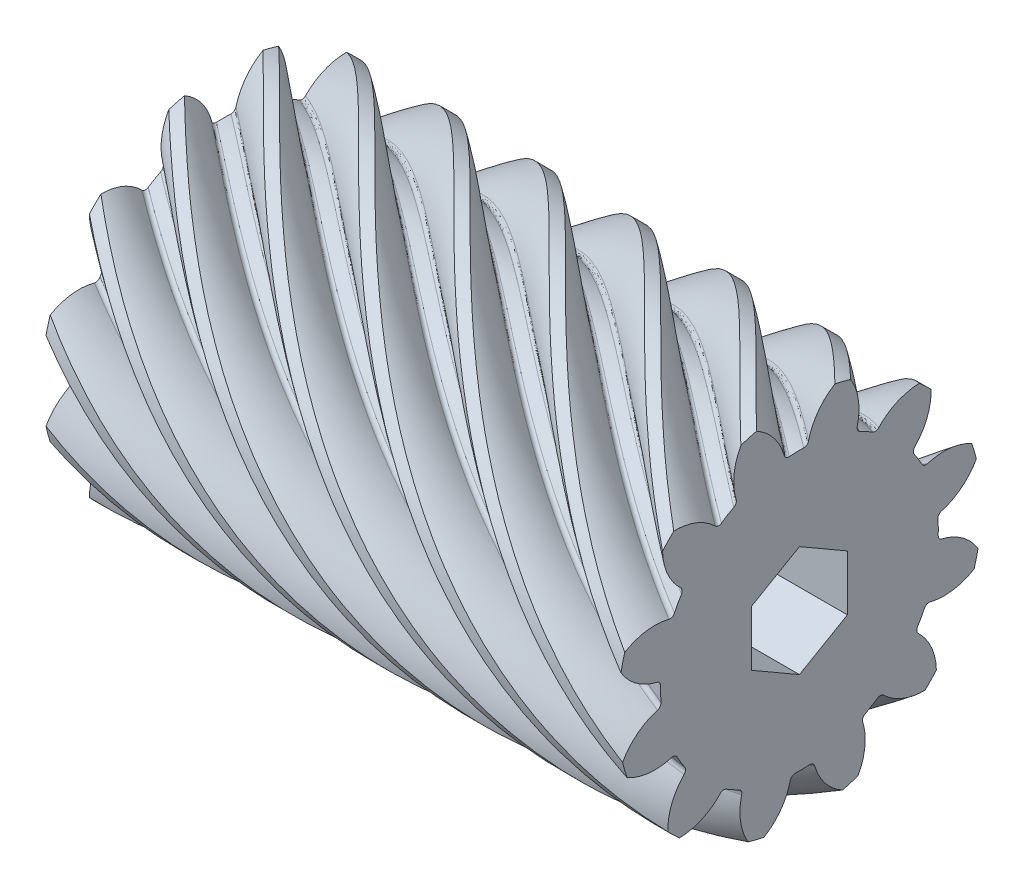
from build123d import *

# Parameters (mm, degrees)
BASPROSKE_W            = 12
BASPROSKE_H            = 3.79411255
TOOTHCUTRH_PITCH       = 23.839112226
TOOTHCUTRH_HEIGHT      = 12
TOOTHCUTRH_RADIUS      = 3.79411255
TOOTHCUTRH_START_ANGLE = -90
TEETHCUTSRH_COUNT      = 12
TEETHCUTSRH_ANGLE      = 330
BORE_DEPTH             = 62.5000025


with BuildPart() as part:
    # BasProSke → Base-Revolve (revolve)
    with BuildSketch(Plane(origin=(0, 0, 0), x_dir=(1, 0, 0), z_dir=(0, 1, 0)), mode=Mode.PRIVATE) as base_revolve_sk:
        with Locations((6, 1.897056275)):
            Rectangle(BASPROSKE_W, BASPROSKE_H)
    revolve(base_revolve_sk.sketch.rotate(Axis((-10, 0, 0), (1, 0, 0)), 180), axis=Axis((-10, 0, 0), (1, 0, 0)))

    # ToothCutRH: sweep along a helix
    with BuildLine() as toothcutrh_path:
        add(Helix(TOOTHCUTRH_PITCH, TOOTHCUTRH_HEIGHT, TOOTHCUTRH_RADIUS, center=(0, 0, 0), direction=(1, 0, 0), mode=Mode.PRIVATE).rotate(Axis((0, 0, 0), (1, 0, 0)), TOOTHCUTRH_START_ANGLE))
    # TooCutSkeRH → ToothCutRH (sweep, cut)
    with BuildSketch(Plane(origin=(0, 0, 0), x_dir=(0, 0, -1), z_dir=(1, 0, 0))):
        with BuildLine():
            ThreePointArc((0.151424845, 2.890148433), (0, 2.89411255), (-0.151424845, 2.890148433))
            ThreePointArc((-0.151424845, 2.890148433), (-0.216419545, 2.909550342), (-0.254484389, 2.965691348))
            ThreePointArc((-0.254484389, 2.965691348), (-0.518983356, 3.461780705), (-0.980404648, 3.782957828))
            ThreePointArc((-0.980404648, 3.782957828), (0, 3.907935926), (0.980404648, 3.782957828))
            ThreePointArc((0.980404648, 3.782957828), (0.518983356, 3.461780705), (0.254484389, 2.965691348))
            ThreePointArc((0.254484389, 2.965691348), (0.216419545, 2.909550342), (0.151424845, 2.890148433))
        make_face()
    toothcutrh = sweep(path=toothcutrh_path.line, is_frenet=True, mode=Mode.SUBTRACT)

    # TeethCutsRH: ToothCutRH ×12 about axis
    teethcutsrh_axis = Axis((-10, 0, 0), (1, 0, 0))
    for i in range(1, TEETHCUTSRH_COUNT):
        add(toothcutrh.rotate(teethcutsrh_axis, i * TEETHCUTSRH_ANGLE / (TEETHCUTSRH_COUNT - 1)), mode=Mode.SUBTRACT)

    # BorSke → Bore (cut, symmetric)
    with BuildSketch(Plane(origin=(0, 0, 0), x_dir=(0, 0, -1), z_dir=(1, 0, 0))):
        Polygon((0, 1.154700538), (-1, 0.577350269), (-1, -0.577350269), (0, -1.154700538), (1, -0.577350269), (1, 0.577350269), align=None)
    extrude(amount=BORE_DEPTH, both=True, mode=Mode.SUBTRACT)


solid = part.part
